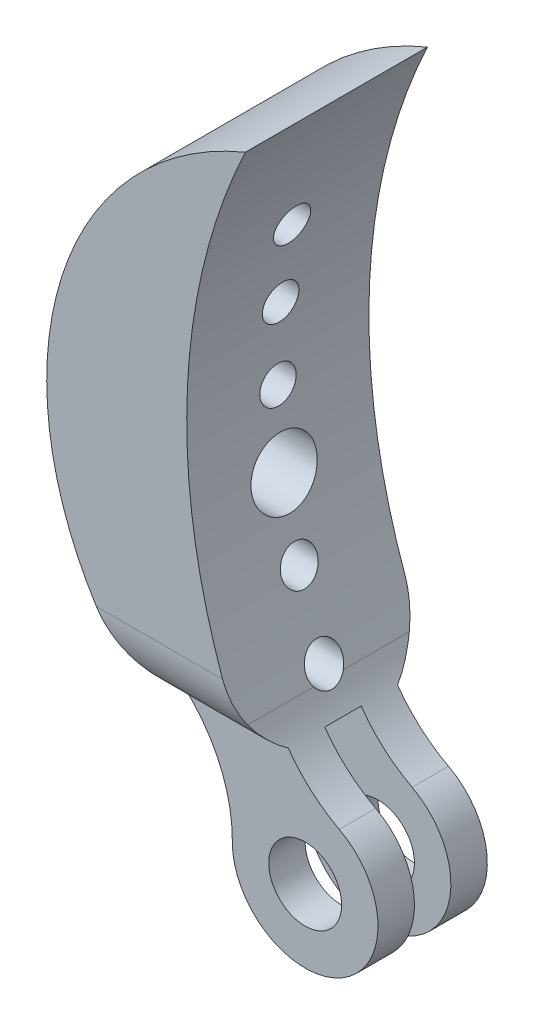
from build123d import *

# Parameters (mm, degrees)
SKETCH1_R                = 2.5
BOSS_EXTRUDE1_DEPTH      = 6.25
BOSS_EXTRUDE2_DEPTH      = 12.5
FILLET2_R                = 10
FILLET3_R                = 10
CUT_EXTRUDE1_START       = -15.233459278
CUT_EXTRUDE1_OUTLINE_R   = 1.25
CUT_EXTRUDE1_OUTLINE_R_2 = 2.25
CUT_EXTRUDE1_DEPTH       = 18.540648536
CUT_EXTRUDE2_DEPTH       = 47.918734753
CUT_EXTRUDE2_DEPTH_BACK  = 47.918734753
SKETCH5_W                = 2.5
SKETCH5_H                = 12.5
FILLET4_R                = 5
SKETCH6_R                = 1.25
CUT_EXTRUDE3_DEPTH       = 5


# Read off the part's stored shape, not the designer's step: Cut-Extrude1
with BuildPart() as part:
    # Sketch1 → Boss-Extrude1 (new, symmetric)
    with BuildSketch(Plane.XY):
        with BuildLine():
            Line((-5, 5), (-5, 0))
            ThreePointArc((-5, 0), (3.535533906, -3.535533906), (0, 5))
            Line((0, 5), (-5, 5))
        make_face()
        Circle(SKETCH1_R, mode=Mode.SUBTRACT)
    extrude(amount=BOSS_EXTRUDE1_DEPTH, both=True)

    # Sketch2 → Boss-Extrude2 (add)
    with BuildSketch(Plane.XY.offset(6.25)):
        with BuildLine():
            Line((-5, 5), (0, 5))
            ThreePointArc((0, 5), (-5.591277584, 24.26974364), (-1.605325779, 43.93437161))
            ThreePointArc((-1.605325779, 43.93437161), (-15.150897111, 25.500229196), (-5, 5))
        make_face()
    extrude(amount=-BOSS_EXTRUDE2_DEPTH)

    # Fillet2
    fillet2_edges = [part.edges().sort_by_distance(p)[0] for p in [
        (-5, 5, 0),
    ]]
    fillet(fillet2_edges, radius=FILLET2_R)

    # Fillet3
    fillet3_edges = [part.edges().sort_by_distance(p)[0] for p in [
        (0, 5, 0),
    ]]
    fillet(fillet3_edges, radius=FILLET3_R)

    # Cut-Extrude1 outline → Cut-Extrude1 (cut)
    with BuildSketch(Plane(origin=(0, 0, 0), x_dir=(0, 0, -1), z_dir=(1, 0, 0)).offset(CUT_EXTRUDE1_START)):
        with Locations((0, 10)):
            Circle(CUT_EXTRUDE1_OUTLINE_R)
        with Locations((0, 5)):
            Circle(CUT_EXTRUDE1_OUTLINE_R)
        with Locations((0, 20)):
            Circle(CUT_EXTRUDE1_OUTLINE_R_2)
        with Locations((0, 30)):
            Circle(CUT_EXTRUDE1_OUTLINE_R)
        with Locations((0, 35)):
            Circle(CUT_EXTRUDE1_OUTLINE_R)
        with Locations((0, 25)):
            Circle(CUT_EXTRUDE1_OUTLINE_R)
        with Locations((0, 15)):
            Circle(CUT_EXTRUDE1_OUTLINE_R)
    extrude(amount=CUT_EXTRUDE1_DEPTH, mode=Mode.SUBTRACT)

    # Sketch5 → Cut-Extrude2 (cut, two sides: drawn at the far end of the back side and taken through both)
    with BuildSketch(Plane(origin=(0, 0, 0), x_dir=(0, 0, -1), z_dir=(1, 0, 0)).offset(-CUT_EXTRUDE2_DEPTH_BACK)):
        with Locations((-5, 1.25)):
            Rectangle(SKETCH5_W, SKETCH5_H)
        Polygon((6.25, 7.462437602), (3.75, 7.5), (3.75, -5), (6.25, -5), align=None)
        with Locations((0, 1.25)):
            Rectangle(SKETCH5_W, SKETCH5_H)
    extrude(amount=CUT_EXTRUDE2_DEPTH + CUT_EXTRUDE2_DEPTH_BACK, mode=Mode.SUBTRACT)

    # Fillet4
    # the kernel refuses this fillet: 5 mm, written as the material it takes off along each edge
    with BuildSketch(Plane(origin=(9.788619451, 7.462437602, -6.25), x_dir=(0, 1, 0), z_dir=(-1, 0, 0))) as fillet4_piece_1:
        with BuildLine():
            CenterArc((4.367689417, -5), FILLET4_R, 90, 60)
            Line((0.037562398, -2.5), (-0.049040142, -2.45))
            ThreePointArc((-0.049040142, -2.45), (-0.081207515, -1.251502326), (-0.099988714, -0.001502326))
            Line((-0.099988714, -0.001502326), (0, 0.1))
            Line((0, 0.1), (4.367689417, 0.1))
            Line((4.367689417, 0.1), (4.367689417, 0))
        make_face()
    extrude(amount=28.905982283, mode=Mode.SUBTRACT)
    with BuildSketch(Plane(origin=(-19.063836372, 7.5, 6.25), x_dir=(0, 0, -1), z_dir=(1, 0, 0))) as fillet4_piece_2:
        with BuildLine():
            CenterArc((5, 4.330127019), FILLET4_R, 180, 60)
            Line((0, 4.330127019), (-0.1, 4.330127019))
            Line((-0.1, 4.330127019), (-0.1, 0))
            Line((-0.1, 0), (0, -0.1))
            ThreePointArc((0, -0.1), (1.25, -0.1), (2.45, -0.08660254))
            Line((2.45, -0.08660254), (2.5, 0))
        make_face()
    extrude(amount=28.731981901, mode=Mode.SUBTRACT)

    # Sketch6 → Cut-Extrude3 (cut)
    with BuildSketch(Plane.XZ.offset(-7.5)):
        with Locations(Location((-5.738518824, 0, 0), (0, 0, 270))):
            Circle(SKETCH6_R)
    extrude(amount=-CUT_EXTRUDE3_DEPTH, mode=Mode.SUBTRACT)


solid = part.part
